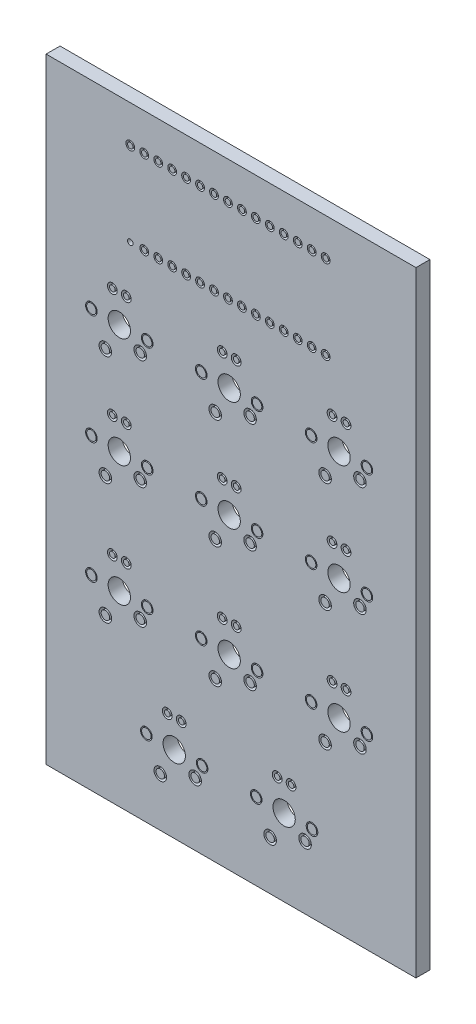
from build123d import *

# Parameters (mm, degrees)
SKETCH2_R           = 0.7999984
SKETCH2_R_2         = 1.143
SKETCH2_R_3         = 1.057148
SKETCH2_R_4         = 0.889
SKETCH2_R_5         = 0.499999
SKETCH2_R_6         = 2.032
BOSS_EXTRUDE2_DEPTH = 2.54


with BuildPart() as part:
    # Sketch2 → Boss-Extrude2 (new body)
    # profile 1 of 96: a face of its own
    with BuildSketch(Plane.XY):
        Polygon((0.6731, 111.99876), (68.00088, 111.99876), (68.00088, 0), (0.6731, 0), (0.6731, 40.5511), align=None)
        with Locations((18.5399934, 89.9999978)):
            Circle(SKETCH2_R, mode=Mode.SUBTRACT)
        with Locations((21.0799934, 89.9999978)):
            Circle(SKETCH2_R, mode=Mode.SUBTRACT)
        with Locations((23.6199934, 89.9999978)):
            Circle(SKETCH2_R, mode=Mode.SUBTRACT)
        with Locations((26.1599934, 89.9999978)):
            Circle(SKETCH2_R, mode=Mode.SUBTRACT)
        with Locations((28.6999934, 89.9999978)):
            Circle(SKETCH2_R, mode=Mode.SUBTRACT)
        with Locations((31.2399934, 89.9999978)):
            Circle(SKETCH2_R, mode=Mode.SUBTRACT)
        with Locations((33.7799934, 89.9999978)):
            Circle(SKETCH2_R, mode=Mode.SUBTRACT)
        with Locations((36.3199934, 89.9999978)):
            Circle(SKETCH2_R, mode=Mode.SUBTRACT)
        with Locations((38.8599934, 89.9999978)):
            Circle(SKETCH2_R, mode=Mode.SUBTRACT)
        with Locations((41.3999934, 89.9999978)):
            Circle(SKETCH2_R, mode=Mode.SUBTRACT)
        with Locations((43.9399934, 89.9999978)):
            Circle(SKETCH2_R, mode=Mode.SUBTRACT)
        with Locations((46.4799934, 89.9999978)):
            Circle(SKETCH2_R, mode=Mode.SUBTRACT)
        with Locations((49.0199934, 89.9999978)):
            Circle(SKETCH2_R, mode=Mode.SUBTRACT)
        with Locations((51.5599934, 89.9999978)):
            Circle(SKETCH2_R, mode=Mode.SUBTRACT)
        with Locations((51.5599934, 105.2399978)):
            Circle(SKETCH2_R, mode=Mode.SUBTRACT)
        with Locations((49.0199934, 105.2399978)):
            Circle(SKETCH2_R, mode=Mode.SUBTRACT)
        with Locations((46.4799934, 105.2399978)):
            Circle(SKETCH2_R, mode=Mode.SUBTRACT)
        with Locations((43.9399934, 105.2399978)):
            Circle(SKETCH2_R, mode=Mode.SUBTRACT)
        with Locations((41.3999934, 105.2399978)):
            Circle(SKETCH2_R, mode=Mode.SUBTRACT)
        with Locations((38.8599934, 105.2399978)):
            Circle(SKETCH2_R, mode=Mode.SUBTRACT)
        with Locations((36.3199934, 105.2399978)):
            Circle(SKETCH2_R, mode=Mode.SUBTRACT)
        with Locations((33.7799934, 105.2399978)):
            Circle(SKETCH2_R, mode=Mode.SUBTRACT)
        with Locations((31.2399934, 105.2399978)):
            Circle(SKETCH2_R, mode=Mode.SUBTRACT)
        with Locations((28.6999934, 105.2399978)):
            Circle(SKETCH2_R, mode=Mode.SUBTRACT)
        with Locations((26.1599934, 105.2399978)):
            Circle(SKETCH2_R, mode=Mode.SUBTRACT)
        with Locations((23.6199934, 105.2399978)):
            Circle(SKETCH2_R, mode=Mode.SUBTRACT)
        with Locations((21.0799934, 105.2399978)):
            Circle(SKETCH2_R, mode=Mode.SUBTRACT)
        with Locations((18.5399934, 105.2399978)):
            Circle(SKETCH2_R, mode=Mode.SUBTRACT)
        with Locations((15.9999934, 105.2399978)):
            Circle(SKETCH2_R, mode=Mode.SUBTRACT)
        with Locations((17.8099974, 53.4599896)):
            Circle(SKETCH2_R_2, mode=Mode.SUBTRACT)
        with Locations((11.4599974, 50.9199896)):
            Circle(SKETCH2_R_2, mode=Mode.SUBTRACT)
        with Locations((19.0799974, 55.9999896)):
            Circle(SKETCH2_R_3, mode=Mode.SUBTRACT)
        with Locations((8.9199974, 55.9999896)):
            Circle(SKETCH2_R_3, mode=Mode.SUBTRACT)
        with Locations((15.2699974, 61.0799896)):
            Circle(SKETCH2_R_4, mode=Mode.SUBTRACT)
        with Locations((12.7299974, 61.0799896)):
            Circle(SKETCH2_R_4, mode=Mode.SUBTRACT)
        with Locations((37.8099828, 53.4599896)):
            Circle(SKETCH2_R_2, mode=Mode.SUBTRACT)
        with Locations((31.4599828, 50.9199896)):
            Circle(SKETCH2_R_2, mode=Mode.SUBTRACT)
        with Locations((39.0799828, 55.9999896)):
            Circle(SKETCH2_R_3, mode=Mode.SUBTRACT)
        with Locations((28.9199828, 55.9999896)):
            Circle(SKETCH2_R_3, mode=Mode.SUBTRACT)
        with Locations((35.2699828, 61.0799896)):
            Circle(SKETCH2_R_4, mode=Mode.SUBTRACT)
        with Locations((32.7299828, 61.0799896)):
            Circle(SKETCH2_R_4, mode=Mode.SUBTRACT)
        with Locations((17.8099974, 31.4599828)):
            Circle(SKETCH2_R_2, mode=Mode.SUBTRACT)
        with Locations((11.4599974, 28.9199828)):
            Circle(SKETCH2_R_2, mode=Mode.SUBTRACT)
        with Locations((19.0799974, 33.9999828)):
            Circle(SKETCH2_R_3, mode=Mode.SUBTRACT)
        with Locations((8.9199974, 33.9999828)):
            Circle(SKETCH2_R_3, mode=Mode.SUBTRACT)
        with Locations((15.2699974, 39.0799828)):
            Circle(SKETCH2_R_4, mode=Mode.SUBTRACT)
        with Locations((12.7299974, 39.0799828)):
            Circle(SKETCH2_R_4, mode=Mode.SUBTRACT)
        with Locations((37.8099828, 31.4599828)):
            Circle(SKETCH2_R_2, mode=Mode.SUBTRACT)
        with Locations((31.4599828, 28.9199828)):
            Circle(SKETCH2_R_2, mode=Mode.SUBTRACT)
        with Locations((39.0799828, 33.9999828)):
            Circle(SKETCH2_R_3, mode=Mode.SUBTRACT)
        with Locations((28.9199828, 33.9999828)):
            Circle(SKETCH2_R_3, mode=Mode.SUBTRACT)
        with Locations((35.2699828, 39.0799828)):
            Circle(SKETCH2_R_4, mode=Mode.SUBTRACT)
        with Locations((32.7299828, 39.0799828)):
            Circle(SKETCH2_R_4, mode=Mode.SUBTRACT)
        with Locations((57.8099936, 53.4599896)):
            Circle(SKETCH2_R_2, mode=Mode.SUBTRACT)
        with Locations((51.4599936, 50.9199896)):
            Circle(SKETCH2_R_2, mode=Mode.SUBTRACT)
        with Locations((59.0799936, 55.9999896)):
            Circle(SKETCH2_R_3, mode=Mode.SUBTRACT)
        with Locations((48.9199936, 55.9999896)):
            Circle(SKETCH2_R_3, mode=Mode.SUBTRACT)
        with Locations((55.2699936, 61.0799896)):
            Circle(SKETCH2_R_4, mode=Mode.SUBTRACT)
        with Locations((52.7299936, 61.0799896)):
            Circle(SKETCH2_R_4, mode=Mode.SUBTRACT)
        with Locations((57.8099936, 31.4599828)):
            Circle(SKETCH2_R_2, mode=Mode.SUBTRACT)
        with Locations((51.4599936, 28.9199828)):
            Circle(SKETCH2_R_2, mode=Mode.SUBTRACT)
        with Locations((59.0799936, 33.9999828)):
            Circle(SKETCH2_R_3, mode=Mode.SUBTRACT)
        with Locations((48.9199936, 33.9999828)):
            Circle(SKETCH2_R_3, mode=Mode.SUBTRACT)
        with Locations((55.2699936, 39.0799828)):
            Circle(SKETCH2_R_4, mode=Mode.SUBTRACT)
        with Locations((52.7299936, 39.0799828)):
            Circle(SKETCH2_R_4, mode=Mode.SUBTRACT)
        with Locations((27.809952, 11.4599974)):
            Circle(SKETCH2_R_2, mode=Mode.SUBTRACT)
        with Locations((21.459952, 8.9199974)):
            Circle(SKETCH2_R_2, mode=Mode.SUBTRACT)
        with Locations((29.079952, 13.9999974)):
            Circle(SKETCH2_R_3, mode=Mode.SUBTRACT)
        with Locations((18.919952, 13.9999974)):
            Circle(SKETCH2_R_3, mode=Mode.SUBTRACT)
        with Locations((25.269952, 19.0799974)):
            Circle(SKETCH2_R_4, mode=Mode.SUBTRACT)
        with Locations((22.729952, 19.0799974)):
            Circle(SKETCH2_R_4, mode=Mode.SUBTRACT)
        with Locations((47.8099882, 11.4599974)):
            Circle(SKETCH2_R_2, mode=Mode.SUBTRACT)
        with Locations((41.4599882, 8.9199974)):
            Circle(SKETCH2_R_2, mode=Mode.SUBTRACT)
        with Locations((49.0799882, 13.9999974)):
            Circle(SKETCH2_R_3, mode=Mode.SUBTRACT)
        with Locations((38.9199882, 13.9999974)):
            Circle(SKETCH2_R_3, mode=Mode.SUBTRACT)
        with Locations((45.2699882, 19.0799974)):
            Circle(SKETCH2_R_4, mode=Mode.SUBTRACT)
        with Locations((42.7299882, 19.0799974)):
            Circle(SKETCH2_R_4, mode=Mode.SUBTRACT)
        with Locations((17.8099974, 73.4600004)):
            Circle(SKETCH2_R_2, mode=Mode.SUBTRACT)
        with Locations((11.4599974, 70.9200004)):
            Circle(SKETCH2_R_2, mode=Mode.SUBTRACT)
        with Locations((19.0799974, 76.0000004)):
            Circle(SKETCH2_R_3, mode=Mode.SUBTRACT)
        with Locations((8.9199974, 76.0000004)):
            Circle(SKETCH2_R_3, mode=Mode.SUBTRACT)
        with Locations((15.2699974, 81.0800004)):
            Circle(SKETCH2_R_4, mode=Mode.SUBTRACT)
        with Locations((12.7299974, 81.0800004)):
            Circle(SKETCH2_R_4, mode=Mode.SUBTRACT)
        with Locations((37.8099828, 73.4600004)):
            Circle(SKETCH2_R_2, mode=Mode.SUBTRACT)
        with Locations((31.4599828, 70.9200004)):
            Circle(SKETCH2_R_2, mode=Mode.SUBTRACT)
        with Locations((39.0799828, 76.0000004)):
            Circle(SKETCH2_R_3, mode=Mode.SUBTRACT)
        with Locations((28.9199828, 76.0000004)):
            Circle(SKETCH2_R_3, mode=Mode.SUBTRACT)
        with Locations((35.2699828, 81.0800004)):
            Circle(SKETCH2_R_4, mode=Mode.SUBTRACT)
        with Locations((32.7299828, 81.0800004)):
            Circle(SKETCH2_R_4, mode=Mode.SUBTRACT)
        with Locations((57.8099936, 73.4600004)):
            Circle(SKETCH2_R_2, mode=Mode.SUBTRACT)
        with Locations((51.4599936, 70.9200004)):
            Circle(SKETCH2_R_2, mode=Mode.SUBTRACT)
        with Locations((59.0799936, 76.0000004)):
            Circle(SKETCH2_R_3, mode=Mode.SUBTRACT)
        with Locations((48.9199936, 76.0000004)):
            Circle(SKETCH2_R_3, mode=Mode.SUBTRACT)
        with Locations((55.2699936, 81.0800004)):
            Circle(SKETCH2_R_4, mode=Mode.SUBTRACT)
        with Locations((52.7299936, 81.0800004)):
            Circle(SKETCH2_R_4, mode=Mode.SUBTRACT)
        with Locations((15.9999934, 89.9999978)):
            Circle(SKETCH2_R_5, mode=Mode.SUBTRACT)
        with Locations((13.9999974, 55.9999896)):
            Circle(SKETCH2_R_6, mode=Mode.SUBTRACT)
        with Locations((33.9999828, 55.9999896)):
            Circle(SKETCH2_R_6, mode=Mode.SUBTRACT)
        with Locations((13.9999974, 33.9999828)):
            Circle(SKETCH2_R_6, mode=Mode.SUBTRACT)
        with Locations((33.9999828, 33.9999828)):
            Circle(SKETCH2_R_6, mode=Mode.SUBTRACT)
        with Locations((53.9999936, 55.9999896)):
            Circle(SKETCH2_R_6, mode=Mode.SUBTRACT)
        with Locations((53.9999936, 33.9999828)):
            Circle(SKETCH2_R_6, mode=Mode.SUBTRACT)
        with Locations((23.9999774, 13.9999974)):
            Circle(SKETCH2_R_6, mode=Mode.SUBTRACT)
        with Locations((43.9999882, 13.9999974)):
            Circle(SKETCH2_R_6, mode=Mode.SUBTRACT)
        with Locations((13.9999974, 76.0000004)):
            Circle(SKETCH2_R_6, mode=Mode.SUBTRACT)
        with Locations((33.9999828, 76.0000004)):
            Circle(SKETCH2_R_6, mode=Mode.SUBTRACT)
        with Locations((53.9999936, 76.0000004)):
            Circle(SKETCH2_R_6, mode=Mode.SUBTRACT)
    # profile 2 of 96: a face of its own
    with BuildSketch(Plane.XY):
        with Locations((15.9999934, 105.2399978)):
            Circle(SKETCH2_R_5)
    # profile 3 of 96: a face of its own
    with BuildSketch(Plane.XY):
        with Locations((18.5399934, 105.2399978)):
            Circle(SKETCH2_R_5)
    # profile 4 of 96: a face of its own
    with BuildSketch(Plane.XY):
        with Locations((21.0799934, 105.2399978)):
            Circle(SKETCH2_R_5)
    # profile 5 of 96: a face of its own
    with BuildSketch(Plane.XY):
        with Locations((23.6199934, 105.2399978)):
            Circle(SKETCH2_R_5)
    # profile 6 of 96: a face of its own
    with BuildSketch(Plane.XY):
        with Locations((26.1599934, 105.2399978)):
            Circle(SKETCH2_R_5)
    # profile 7 of 96: a face of its own
    with BuildSketch(Plane.XY):
        with Locations((28.6999934, 105.2399978)):
            Circle(SKETCH2_R_5)
    # profile 8 of 96: a face of its own
    with BuildSketch(Plane.XY):
        with Locations((31.2399934, 105.2399978)):
            Circle(SKETCH2_R_5)
    # profile 9 of 96: a face of its own
    with BuildSketch(Plane.XY):
        with Locations((33.7799934, 105.2399978)):
            Circle(SKETCH2_R_5)
    # profile 10 of 96: a face of its own
    with BuildSketch(Plane.XY):
        with Locations((36.3199934, 105.2399978)):
            Circle(SKETCH2_R_5)
    # profile 11 of 96: a face of its own
    with BuildSketch(Plane.XY):
        with Locations((38.8599934, 105.2399978)):
            Circle(SKETCH2_R_5)
    # profile 12 of 96: a face of its own
    with BuildSketch(Plane.XY):
        with Locations((41.3999934, 105.2399978)):
            Circle(SKETCH2_R_5)
    # profile 13 of 96: a face of its own
    with BuildSketch(Plane.XY):
        with Locations((43.9399934, 105.2399978)):
            Circle(SKETCH2_R_5)
    # profile 14 of 96: a face of its own
    with BuildSketch(Plane.XY):
        with Locations((46.4799934, 105.2399978)):
            Circle(SKETCH2_R_5)
    # profile 15 of 96: a face of its own
    with BuildSketch(Plane.XY):
        with Locations((49.0199934, 105.2399978)):
            Circle(SKETCH2_R_5)
    # profile 16 of 96: a face of its own
    with BuildSketch(Plane.XY):
        with Locations((51.5599934, 105.2399978)):
            Circle(SKETCH2_R_5)
    # profile 17 of 96: a face of its own
    with BuildSketch(Plane.XY):
        with Locations((51.5599934, 89.9999978)):
            Circle(SKETCH2_R_5)
    # profile 18 of 96: a face of its own
    with BuildSketch(Plane.XY):
        with Locations((49.0199934, 89.9999978)):
            Circle(SKETCH2_R_5)
    # profile 19 of 96: a face of its own
    with BuildSketch(Plane.XY):
        with Locations((46.4799934, 89.9999978)):
            Circle(SKETCH2_R_5)
    # profile 20 of 96: a face of its own
    with BuildSketch(Plane.XY):
        with Locations((43.9399934, 89.9999978)):
            Circle(SKETCH2_R_5)
    # profile 21 of 96: a face of its own
    with BuildSketch(Plane.XY):
        with Locations((41.3999934, 89.9999978)):
            Circle(SKETCH2_R_5)
    # profile 22 of 96: a face of its own
    with BuildSketch(Plane.XY):
        with Locations((38.8599934, 89.9999978)):
            Circle(SKETCH2_R_5)
    # profile 23 of 96: a face of its own
    with BuildSketch(Plane.XY):
        with Locations((36.3199934, 89.9999978)):
            Circle(SKETCH2_R_5)
    # profile 24 of 96: a face of its own
    with BuildSketch(Plane.XY):
        with Locations((33.7799934, 89.9999978)):
            Circle(SKETCH2_R_5)
    # profile 25 of 96: a face of its own
    with BuildSketch(Plane.XY):
        with Locations((31.2399934, 89.9999978)):
            Circle(SKETCH2_R_5)
    # profile 26 of 96: a face of its own
    with BuildSketch(Plane.XY):
        with Locations((28.6999934, 89.9999978)):
            Circle(SKETCH2_R_5)
    # profile 27 of 96: a face of its own
    with BuildSketch(Plane.XY):
        with Locations((26.1599934, 89.9999978)):
            Circle(SKETCH2_R_5)
    # profile 28 of 96: a face of its own
    with BuildSketch(Plane.XY):
        with Locations((23.6199934, 89.9999978)):
            Circle(SKETCH2_R_5)
    # profile 29 of 96: a face of its own
    with BuildSketch(Plane.XY):
        with Locations((21.0799934, 89.9999978)):
            Circle(SKETCH2_R_5)
    # profile 30 of 96: a face of its own
    with BuildSketch(Plane.XY):
        with Locations((18.5399934, 89.9999978)):
            Circle(SKETCH2_R_5)
    # profile 31 of 96: a face of its own
    with BuildSketch(Plane.XY):
        with BuildLine():
            Line((17.8074574, 52.6979896), (17.8125374, 52.6979896))
            ThreePointArc((17.8125374, 52.6979896), (18.5745374, 53.4599896), (17.8125374, 54.2219896))
            Line((17.8125374, 54.2219896), (17.8074574, 54.2219896))
            ThreePointArc((17.8074574, 54.2219896), (17.0454574, 53.4599896), (17.8074574, 52.6979896))
        make_face()
    # profile 32 of 96: a face of its own
    with BuildSketch(Plane.XY):
        with BuildLine():
            Line((11.4574574, 50.1579896), (11.4625374, 50.1579896))
            ThreePointArc((11.4625374, 50.1579896), (12.2245374, 50.9199896), (11.4625374, 51.6819896))
            Line((11.4625374, 51.6819896), (11.4574574, 51.6819896))
            ThreePointArc((11.4574574, 51.6819896), (10.6954574, 50.9199896), (11.4574574, 50.1579896))
        make_face()
    # profile 33 of 96: a face of its own
    with BuildSketch(Plane.XY):
        with BuildLine():
            Line((19.0774574, 55.1427396), (19.0825374, 55.1427396))
            ThreePointArc((19.0825374, 55.1427396), (19.9397874, 55.9999896), (19.0825374, 56.8572396))
            Line((19.0825374, 56.8572396), (19.0774574, 56.8572396))
            ThreePointArc((19.0774574, 56.8572396), (18.2202074, 55.9999896), (19.0774574, 55.1427396))
        make_face()
    # profile 34 of 96: a face of its own
    with BuildSketch(Plane.XY):
        with BuildLine():
            Line((8.9174574, 55.1427396), (8.9225374, 55.1427396))
            ThreePointArc((8.9225374, 55.1427396), (9.7797874, 55.9999896), (8.9225374, 56.8572396))
            Line((8.9225374, 56.8572396), (8.9174574, 56.8572396))
            ThreePointArc((8.9174574, 56.8572396), (8.0602074, 55.9999896), (8.9174574, 55.1427396))
        make_face()
    # profile 35 of 96: a face of its own
    with BuildSketch(Plane.XY):
        with BuildLine():
            Line((15.2674574, 60.5719896), (15.2725374, 60.5719896))
            ThreePointArc((15.2725374, 60.5719896), (15.7805374, 61.0799896), (15.2725374, 61.5879896))
            Line((15.2725374, 61.5879896), (15.2674574, 61.5879896))
            ThreePointArc((15.2674574, 61.5879896), (14.7594574, 61.0799896), (15.2674574, 60.5719896))
        make_face()
    # profile 36 of 96: a face of its own
    with BuildSketch(Plane.XY):
        with BuildLine():
            Line((12.7274574, 60.5719896), (12.7325374, 60.5719896))
            ThreePointArc((12.7325374, 60.5719896), (13.2405374, 61.0799896), (12.7325374, 61.5879896))
            Line((12.7325374, 61.5879896), (12.7274574, 61.5879896))
            ThreePointArc((12.7274574, 61.5879896), (12.2194574, 61.0799896), (12.7274574, 60.5719896))
        make_face()
    # profile 37 of 96: a face of its own
    with BuildSketch(Plane.XY):
        with BuildLine():
            Line((37.8074428, 52.6979896), (37.8125228, 52.6979896))
            ThreePointArc((37.8125228, 52.6979896), (38.5745228, 53.4599896), (37.8125228, 54.2219896))
            Line((37.8125228, 54.2219896), (37.8074428, 54.2219896))
            ThreePointArc((37.8074428, 54.2219896), (37.0454428, 53.4599896), (37.8074428, 52.6979896))
        make_face()
    # profile 38 of 96: a face of its own
    with BuildSketch(Plane.XY):
        with BuildLine():
            Line((31.4574428, 50.1579896), (31.4625228, 50.1579896))
            ThreePointArc((31.4625228, 50.1579896), (32.2245228, 50.9199896), (31.4625228, 51.6819896))
            Line((31.4625228, 51.6819896), (31.4574428, 51.6819896))
            ThreePointArc((31.4574428, 51.6819896), (30.6954428, 50.9199896), (31.4574428, 50.1579896))
        make_face()
    # profile 39 of 96: a face of its own
    with BuildSketch(Plane.XY):
        with BuildLine():
            Line((39.0774428, 55.1427396), (39.0825228, 55.1427396))
            ThreePointArc((39.0825228, 55.1427396), (39.9397728, 55.9999896), (39.0825228, 56.8572396))
            Line((39.0825228, 56.8572396), (39.0774428, 56.8572396))
            ThreePointArc((39.0774428, 56.8572396), (38.2201928, 55.9999896), (39.0774428, 55.1427396))
        make_face()
    # profile 40 of 96: a face of its own
    with BuildSketch(Plane.XY):
        with BuildLine():
            Line((28.9174428, 55.1427396), (28.9225228, 55.1427396))
            ThreePointArc((28.9225228, 55.1427396), (29.7797728, 55.9999896), (28.9225228, 56.8572396))
            Line((28.9225228, 56.8572396), (28.9174428, 56.8572396))
            ThreePointArc((28.9174428, 56.8572396), (28.0601928, 55.9999896), (28.9174428, 55.1427396))
        make_face()
    # profile 41 of 96: a face of its own
    with BuildSketch(Plane.XY):
        with BuildLine():
            Line((35.2674428, 60.5719896), (35.2725228, 60.5719896))
            ThreePointArc((35.2725228, 60.5719896), (35.7805228, 61.0799896), (35.2725228, 61.5879896))
            Line((35.2725228, 61.5879896), (35.2674428, 61.5879896))
            ThreePointArc((35.2674428, 61.5879896), (34.7594428, 61.0799896), (35.2674428, 60.5719896))
        make_face()
    # profile 42 of 96: a face of its own
    with BuildSketch(Plane.XY):
        with BuildLine():
            Line((32.7274428, 60.5719896), (32.7325228, 60.5719896))
            ThreePointArc((32.7325228, 60.5719896), (33.2405228, 61.0799896), (32.7325228, 61.5879896))
            Line((32.7325228, 61.5879896), (32.7274428, 61.5879896))
            ThreePointArc((32.7274428, 61.5879896), (32.2194428, 61.0799896), (32.7274428, 60.5719896))
        make_face()
    # profile 43 of 96: a face of its own
    with BuildSketch(Plane.XY):
        with BuildLine():
            Line((17.8074574, 30.6979828), (17.8125374, 30.6979828))
            ThreePointArc((17.8125374, 30.6979828), (18.5745374, 31.4599828), (17.8125374, 32.2219828))
            Line((17.8125374, 32.2219828), (17.8074574, 32.2219828))
            ThreePointArc((17.8074574, 32.2219828), (17.0454574, 31.4599828), (17.8074574, 30.6979828))
        make_face()
    # profile 44 of 96: a face of its own
    with BuildSketch(Plane.XY):
        with BuildLine():
            Line((11.4574574, 28.1579828), (11.4625374, 28.1579828))
            ThreePointArc((11.4625374, 28.1579828), (12.2245374, 28.9199828), (11.4625374, 29.6819828))
            Line((11.4625374, 29.6819828), (11.4574574, 29.6819828))
            ThreePointArc((11.4574574, 29.6819828), (10.6954574, 28.9199828), (11.4574574, 28.1579828))
        make_face()
    # profile 45 of 96: a face of its own
    with BuildSketch(Plane.XY):
        with BuildLine():
            Line((19.0774574, 33.1427328), (19.0825374, 33.1427328))
            ThreePointArc((19.0825374, 33.1427328), (19.9397874, 33.9999828), (19.0825374, 34.8572328))
            Line((19.0825374, 34.8572328), (19.0774574, 34.8572328))
            ThreePointArc((19.0774574, 34.8572328), (18.2202074, 33.9999828), (19.0774574, 33.1427328))
        make_face()
    # profile 46 of 96: a face of its own
    with BuildSketch(Plane.XY):
        with BuildLine():
            Line((8.9174574, 33.1427328), (8.9225374, 33.1427328))
            ThreePointArc((8.9225374, 33.1427328), (9.7797874, 33.9999828), (8.9225374, 34.8572328))
            Line((8.9225374, 34.8572328), (8.9174574, 34.8572328))
            ThreePointArc((8.9174574, 34.8572328), (8.0602074, 33.9999828), (8.9174574, 33.1427328))
        make_face()
    # profile 47 of 96: a face of its own
    with BuildSketch(Plane.XY):
        with BuildLine():
            Line((15.2674574, 38.5719828), (15.2725374, 38.5719828))
            ThreePointArc((15.2725374, 38.5719828), (15.7805374, 39.0799828), (15.2725374, 39.5879828))
            Line((15.2725374, 39.5879828), (15.2674574, 39.5879828))
            ThreePointArc((15.2674574, 39.5879828), (14.7594574, 39.0799828), (15.2674574, 38.5719828))
        make_face()
    # profile 48 of 96: a face of its own
    with BuildSketch(Plane.XY):
        with BuildLine():
            Line((12.7274574, 38.5719828), (12.7325374, 38.5719828))
            ThreePointArc((12.7325374, 38.5719828), (13.2405374, 39.0799828), (12.7325374, 39.5879828))
            Line((12.7325374, 39.5879828), (12.7274574, 39.5879828))
            ThreePointArc((12.7274574, 39.5879828), (12.2194574, 39.0799828), (12.7274574, 38.5719828))
        make_face()
    # profile 49 of 96: a face of its own
    with BuildSketch(Plane.XY):
        with BuildLine():
            Line((37.8074428, 30.6979828), (37.8125228, 30.6979828))
            ThreePointArc((37.8125228, 30.6979828), (38.5745228, 31.4599828), (37.8125228, 32.2219828))
            Line((37.8125228, 32.2219828), (37.8074428, 32.2219828))
            ThreePointArc((37.8074428, 32.2219828), (37.0454428, 31.4599828), (37.8074428, 30.6979828))
        make_face()
    # profile 50 of 96: a face of its own
    with BuildSketch(Plane.XY):
        with BuildLine():
            Line((31.4574428, 28.1579828), (31.4625228, 28.1579828))
            ThreePointArc((31.4625228, 28.1579828), (32.2245228, 28.9199828), (31.4625228, 29.6819828))
            Line((31.4625228, 29.6819828), (31.4574428, 29.6819828))
            ThreePointArc((31.4574428, 29.6819828), (30.6954428, 28.9199828), (31.4574428, 28.1579828))
        make_face()
    # profile 51 of 96: a face of its own
    with BuildSketch(Plane.XY):
        with BuildLine():
            Line((39.0774428, 33.1427328), (39.0825228, 33.1427328))
            ThreePointArc((39.0825228, 33.1427328), (39.9397728, 33.9999828), (39.0825228, 34.8572328))
            Line((39.0825228, 34.8572328), (39.0774428, 34.8572328))
            ThreePointArc((39.0774428, 34.8572328), (38.2201928, 33.9999828), (39.0774428, 33.1427328))
        make_face()
    # profile 52 of 96: a face of its own
    with BuildSketch(Plane.XY):
        with BuildLine():
            Line((28.9174428, 33.1427328), (28.9225228, 33.1427328))
            ThreePointArc((28.9225228, 33.1427328), (29.7797728, 33.9999828), (28.9225228, 34.8572328))
            Line((28.9225228, 34.8572328), (28.9174428, 34.8572328))
            ThreePointArc((28.9174428, 34.8572328), (28.0601928, 33.9999828), (28.9174428, 33.1427328))
        make_face()
    # profile 53 of 96: a face of its own
    with BuildSketch(Plane.XY):
        with BuildLine():
            Line((35.2674428, 38.5719828), (35.2725228, 38.5719828))
            ThreePointArc((35.2725228, 38.5719828), (35.7805228, 39.0799828), (35.2725228, 39.5879828))
            Line((35.2725228, 39.5879828), (35.2674428, 39.5879828))
            ThreePointArc((35.2674428, 39.5879828), (34.7594428, 39.0799828), (35.2674428, 38.5719828))
        make_face()
    # profile 54 of 96: a face of its own
    with BuildSketch(Plane.XY):
        with BuildLine():
            Line((32.7274428, 38.5719828), (32.7325228, 38.5719828))
            ThreePointArc((32.7325228, 38.5719828), (33.2405228, 39.0799828), (32.7325228, 39.5879828))
            Line((32.7325228, 39.5879828), (32.7274428, 39.5879828))
            ThreePointArc((32.7274428, 39.5879828), (32.2194428, 39.0799828), (32.7274428, 38.5719828))
        make_face()
    # profile 55 of 96: a face of its own
    with BuildSketch(Plane.XY):
        with BuildLine():
            Line((57.8074536, 52.6979896), (57.8125336, 52.6979896))
            ThreePointArc((57.8125336, 52.6979896), (58.5745336, 53.4599896), (57.8125336, 54.2219896))
            Line((57.8125336, 54.2219896), (57.8074536, 54.2219896))
            ThreePointArc((57.8074536, 54.2219896), (57.0454536, 53.4599896), (57.8074536, 52.6979896))
        make_face()
    # profile 56 of 96: a face of its own
    with BuildSketch(Plane.XY):
        with BuildLine():
            Line((51.4574536, 50.1579896), (51.4625336, 50.1579896))
            ThreePointArc((51.4625336, 50.1579896), (52.2245336, 50.9199896), (51.4625336, 51.6819896))
            Line((51.4625336, 51.6819896), (51.4574536, 51.6819896))
            ThreePointArc((51.4574536, 51.6819896), (50.6954536, 50.9199896), (51.4574536, 50.1579896))
        make_face()
    # profile 57 of 96: a face of its own
    with BuildSketch(Plane.XY):
        with BuildLine():
            Line((59.0774536, 55.1427396), (59.0825336, 55.1427396))
            ThreePointArc((59.0825336, 55.1427396), (59.9397836, 55.9999896), (59.0825336, 56.8572396))
            Line((59.0825336, 56.8572396), (59.0774536, 56.8572396))
            ThreePointArc((59.0774536, 56.8572396), (58.2202036, 55.9999896), (59.0774536, 55.1427396))
        make_face()
    # profile 58 of 96: a face of its own
    with BuildSketch(Plane.XY):
        with BuildLine():
            Line((48.9174536, 55.1427396), (48.9225336, 55.1427396))
            ThreePointArc((48.9225336, 55.1427396), (49.7797836, 55.9999896), (48.9225336, 56.8572396))
            Line((48.9225336, 56.8572396), (48.9174536, 56.8572396))
            ThreePointArc((48.9174536, 56.8572396), (48.0602036, 55.9999896), (48.9174536, 55.1427396))
        make_face()
    # profile 59 of 96: a face of its own
    with BuildSketch(Plane.XY):
        with BuildLine():
            Line((55.2674536, 60.5719896), (55.2725336, 60.5719896))
            ThreePointArc((55.2725336, 60.5719896), (55.7805336, 61.0799896), (55.2725336, 61.5879896))
            Line((55.2725336, 61.5879896), (55.2674536, 61.5879896))
            ThreePointArc((55.2674536, 61.5879896), (54.7594536, 61.0799896), (55.2674536, 60.5719896))
        make_face()
    # profile 60 of 96: a face of its own
    with BuildSketch(Plane.XY):
        with BuildLine():
            Line((52.7274536, 60.5719896), (52.7325336, 60.5719896))
            ThreePointArc((52.7325336, 60.5719896), (53.2405336, 61.0799896), (52.7325336, 61.5879896))
            Line((52.7325336, 61.5879896), (52.7274536, 61.5879896))
            ThreePointArc((52.7274536, 61.5879896), (52.2194536, 61.0799896), (52.7274536, 60.5719896))
        make_face()
    # profile 61 of 96: a face of its own
    with BuildSketch(Plane.XY):
        with BuildLine():
            Line((57.8074536, 30.6979828), (57.8125336, 30.6979828))
            ThreePointArc((57.8125336, 30.6979828), (58.5745336, 31.4599828), (57.8125336, 32.2219828))
            Line((57.8125336, 32.2219828), (57.8074536, 32.2219828))
            ThreePointArc((57.8074536, 32.2219828), (57.0454536, 31.4599828), (57.8074536, 30.6979828))
        make_face()
    # profile 62 of 96: a face of its own
    with BuildSketch(Plane.XY):
        with BuildLine():
            Line((51.4574536, 28.1579828), (51.4625336, 28.1579828))
            ThreePointArc((51.4625336, 28.1579828), (52.2245336, 28.9199828), (51.4625336, 29.6819828))
            Line((51.4625336, 29.6819828), (51.4574536, 29.6819828))
            ThreePointArc((51.4574536, 29.6819828), (50.6954536, 28.9199828), (51.4574536, 28.1579828))
        make_face()
    # profile 63 of 96: a face of its own
    with BuildSketch(Plane.XY):
        with BuildLine():
            Line((59.0774536, 33.1427328), (59.0825336, 33.1427328))
            ThreePointArc((59.0825336, 33.1427328), (59.9397836, 33.9999828), (59.0825336, 34.8572328))
            Line((59.0825336, 34.8572328), (59.0774536, 34.8572328))
            ThreePointArc((59.0774536, 34.8572328), (58.2202036, 33.9999828), (59.0774536, 33.1427328))
        make_face()
    # profile 64 of 96: a face of its own
    with BuildSketch(Plane.XY):
        with BuildLine():
            Line((48.9174536, 33.1427328), (48.9225336, 33.1427328))
            ThreePointArc((48.9225336, 33.1427328), (49.7797836, 33.9999828), (48.9225336, 34.8572328))
            Line((48.9225336, 34.8572328), (48.9174536, 34.8572328))
            ThreePointArc((48.9174536, 34.8572328), (48.0602036, 33.9999828), (48.9174536, 33.1427328))
        make_face()
    # profile 65 of 96: a face of its own
    with BuildSketch(Plane.XY):
        with BuildLine():
            Line((55.2674536, 38.5719828), (55.2725336, 38.5719828))
            ThreePointArc((55.2725336, 38.5719828), (55.7805336, 39.0799828), (55.2725336, 39.5879828))
            Line((55.2725336, 39.5879828), (55.2674536, 39.5879828))
            ThreePointArc((55.2674536, 39.5879828), (54.7594536, 39.0799828), (55.2674536, 38.5719828))
        make_face()
    # profile 66 of 96: a face of its own
    with BuildSketch(Plane.XY):
        with BuildLine():
            Line((52.7274536, 38.5719828), (52.7325336, 38.5719828))
            ThreePointArc((52.7325336, 38.5719828), (53.2405336, 39.0799828), (52.7325336, 39.5879828))
            Line((52.7325336, 39.5879828), (52.7274536, 39.5879828))
            ThreePointArc((52.7274536, 39.5879828), (52.2194536, 39.0799828), (52.7274536, 38.5719828))
        make_face()
    # profile 67 of 96: a face of its own
    with BuildSketch(Plane.XY):
        with BuildLine():
            Line((27.807412, 10.6979974), (27.812492, 10.6979974))
            ThreePointArc((27.812492, 10.6979974), (28.574492, 11.4599974), (27.812492, 12.2219974))
            Line((27.812492, 12.2219974), (27.807412, 12.2219974))
            ThreePointArc((27.807412, 12.2219974), (27.045412, 11.4599974), (27.807412, 10.6979974))
        make_face()
    # profile 68 of 96: a face of its own
    with BuildSketch(Plane.XY):
        with BuildLine():
            Line((21.457412, 8.1579974), (21.462492, 8.1579974))
            ThreePointArc((21.462492, 8.1579974), (22.224492, 8.9199974), (21.462492, 9.6819974))
            Line((21.462492, 9.6819974), (21.457412, 9.6819974))
            ThreePointArc((21.457412, 9.6819974), (20.695412, 8.9199974), (21.457412, 8.1579974))
        make_face()
    # profile 69 of 96: a face of its own
    with BuildSketch(Plane.XY):
        with BuildLine():
            Line((29.077412, 13.1427474), (29.082492, 13.1427474))
            ThreePointArc((29.082492, 13.1427474), (29.939742, 13.9999974), (29.082492, 14.8572474))
            Line((29.082492, 14.8572474), (29.077412, 14.8572474))
            ThreePointArc((29.077412, 14.8572474), (28.220162, 13.9999974), (29.077412, 13.1427474))
        make_face()
    # profile 70 of 96: a face of its own
    with BuildSketch(Plane.XY):
        with BuildLine():
            Line((18.917412, 13.1427474), (18.922492, 13.1427474))
            ThreePointArc((18.922492, 13.1427474), (19.779742, 13.9999974), (18.922492, 14.8572474))
            Line((18.922492, 14.8572474), (18.917412, 14.8572474))
            ThreePointArc((18.917412, 14.8572474), (18.060162, 13.9999974), (18.917412, 13.1427474))
        make_face()
    # profile 71 of 96: a face of its own
    with BuildSketch(Plane.XY):
        with BuildLine():
            Line((25.267412, 18.5719974), (25.272492, 18.5719974))
            ThreePointArc((25.272492, 18.5719974), (25.780492, 19.0799974), (25.272492, 19.5879974))
            Line((25.272492, 19.5879974), (25.267412, 19.5879974))
            ThreePointArc((25.267412, 19.5879974), (24.759412, 19.0799974), (25.267412, 18.5719974))
        make_face()
    # profile 72 of 96: a face of its own
    with BuildSketch(Plane.XY):
        with BuildLine():
            Line((22.727412, 18.5719974), (22.732492, 18.5719974))
            ThreePointArc((22.732492, 18.5719974), (23.240492, 19.0799974), (22.732492, 19.5879974))
            Line((22.732492, 19.5879974), (22.727412, 19.5879974))
            ThreePointArc((22.727412, 19.5879974), (22.219412, 19.0799974), (22.727412, 18.5719974))
        make_face()
    # profile 73 of 96: a face of its own
    with BuildSketch(Plane.XY):
        with BuildLine():
            Line((47.8074482, 10.6979974), (47.8125282, 10.6979974))
            ThreePointArc((47.8125282, 10.6979974), (48.5745282, 11.4599974), (47.8125282, 12.2219974))
            Line((47.8125282, 12.2219974), (47.8074482, 12.2219974))
            ThreePointArc((47.8074482, 12.2219974), (47.0454482, 11.4599974), (47.8074482, 10.6979974))
        make_face()
    # profile 74 of 96: a face of its own
    with BuildSketch(Plane.XY):
        with BuildLine():
            Line((41.4574482, 8.1579974), (41.4625282, 8.1579974))
            ThreePointArc((41.4625282, 8.1579974), (42.2245282, 8.9199974), (41.4625282, 9.6819974))
            Line((41.4625282, 9.6819974), (41.4574482, 9.6819974))
            ThreePointArc((41.4574482, 9.6819974), (40.6954482, 8.9199974), (41.4574482, 8.1579974))
        make_face()
    # profile 75 of 96: a face of its own
    with BuildSketch(Plane.XY):
        with BuildLine():
            Line((49.0774482, 13.1427474), (49.0825282, 13.1427474))
            ThreePointArc((49.0825282, 13.1427474), (49.9397782, 13.9999974), (49.0825282, 14.8572474))
            Line((49.0825282, 14.8572474), (49.0774482, 14.8572474))
            ThreePointArc((49.0774482, 14.8572474), (48.2201982, 13.9999974), (49.0774482, 13.1427474))
        make_face()
    # profile 76 of 96: a face of its own
    with BuildSketch(Plane.XY):
        with BuildLine():
            Line((38.9174482, 13.1427474), (38.9225282, 13.1427474))
            ThreePointArc((38.9225282, 13.1427474), (39.7797782, 13.9999974), (38.9225282, 14.8572474))
            Line((38.9225282, 14.8572474), (38.9174482, 14.8572474))
            ThreePointArc((38.9174482, 14.8572474), (38.0601982, 13.9999974), (38.9174482, 13.1427474))
        make_face()
    # profile 77 of 96: a face of its own
    with BuildSketch(Plane.XY):
        with BuildLine():
            Line((45.2674482, 18.5719974), (45.2725282, 18.5719974))
            ThreePointArc((45.2725282, 18.5719974), (45.7805282, 19.0799974), (45.2725282, 19.5879974))
            Line((45.2725282, 19.5879974), (45.2674482, 19.5879974))
            ThreePointArc((45.2674482, 19.5879974), (44.7594482, 19.0799974), (45.2674482, 18.5719974))
        make_face()
    # profile 78 of 96: a face of its own
    with BuildSketch(Plane.XY):
        with BuildLine():
            Line((42.7274482, 18.5719974), (42.7325282, 18.5719974))
            ThreePointArc((42.7325282, 18.5719974), (43.2405282, 19.0799974), (42.7325282, 19.5879974))
            Line((42.7325282, 19.5879974), (42.7274482, 19.5879974))
            ThreePointArc((42.7274482, 19.5879974), (42.2194482, 19.0799974), (42.7274482, 18.5719974))
        make_face()
    # profile 79 of 96: a face of its own
    with BuildSketch(Plane.XY):
        with BuildLine():
            Line((17.8074574, 72.6980004), (17.8125374, 72.6980004))
            ThreePointArc((17.8125374, 72.6980004), (18.5745374, 73.4600004), (17.8125374, 74.2220004))
            Line((17.8125374, 74.2220004), (17.8074574, 74.2220004))
            ThreePointArc((17.8074574, 74.2220004), (17.0454574, 73.4600004), (17.8074574, 72.6980004))
        make_face()
    # profile 80 of 96: a face of its own
    with BuildSketch(Plane.XY):
        with BuildLine():
            Line((11.4574574, 70.1580004), (11.4625374, 70.1580004))
            ThreePointArc((11.4625374, 70.1580004), (12.2245374, 70.9200004), (11.4625374, 71.6820004))
            Line((11.4625374, 71.6820004), (11.4574574, 71.6820004))
            ThreePointArc((11.4574574, 71.6820004), (10.6954574, 70.9200004), (11.4574574, 70.1580004))
        make_face()
    # profile 81 of 96: a face of its own
    with BuildSketch(Plane.XY):
        with BuildLine():
            Line((19.0774574, 75.1427504), (19.0825374, 75.1427504))
            ThreePointArc((19.0825374, 75.1427504), (19.9397874, 76.0000004), (19.0825374, 76.8572504))
            Line((19.0825374, 76.8572504), (19.0774574, 76.8572504))
            ThreePointArc((19.0774574, 76.8572504), (18.2202074, 76.0000004), (19.0774574, 75.1427504))
        make_face()
    # profile 82 of 96: a face of its own
    with BuildSketch(Plane.XY):
        with BuildLine():
            Line((8.9174574, 75.1427504), (8.9225374, 75.1427504))
            ThreePointArc((8.9225374, 75.1427504), (9.7797874, 76.0000004), (8.9225374, 76.8572504))
            Line((8.9225374, 76.8572504), (8.9174574, 76.8572504))
            ThreePointArc((8.9174574, 76.8572504), (8.0602074, 76.0000004), (8.9174574, 75.1427504))
        make_face()
    # profile 83 of 96: a face of its own
    with BuildSketch(Plane.XY):
        with BuildLine():
            Line((15.2674574, 80.5720004), (15.2725374, 80.5720004))
            ThreePointArc((15.2725374, 80.5720004), (15.7805374, 81.0800004), (15.2725374, 81.5880004))
            Line((15.2725374, 81.5880004), (15.2674574, 81.5880004))
            ThreePointArc((15.2674574, 81.5880004), (14.7594574, 81.0800004), (15.2674574, 80.5720004))
        make_face()
    # profile 84 of 96: a face of its own
    with BuildSketch(Plane.XY):
        with BuildLine():
            Line((12.7274574, 80.5720004), (12.7325374, 80.5720004))
            ThreePointArc((12.7325374, 80.5720004), (13.2405374, 81.0800004), (12.7325374, 81.5880004))
            Line((12.7325374, 81.5880004), (12.7274574, 81.5880004))
            ThreePointArc((12.7274574, 81.5880004), (12.2194574, 81.0800004), (12.7274574, 80.5720004))
        make_face()
    # profile 85 of 96: a face of its own
    with BuildSketch(Plane.XY):
        with BuildLine():
            Line((37.8074428, 72.6980004), (37.8125228, 72.6980004))
            ThreePointArc((37.8125228, 72.6980004), (38.5745228, 73.4600004), (37.8125228, 74.2220004))
            Line((37.8125228, 74.2220004), (37.8074428, 74.2220004))
            ThreePointArc((37.8074428, 74.2220004), (37.0454428, 73.4600004), (37.8074428, 72.6980004))
        make_face()
    # profile 86 of 96: a face of its own
    with BuildSketch(Plane.XY):
        with BuildLine():
            Line((31.4574428, 70.1580004), (31.4625228, 70.1580004))
            ThreePointArc((31.4625228, 70.1580004), (32.2245228, 70.9200004), (31.4625228, 71.6820004))
            Line((31.4625228, 71.6820004), (31.4574428, 71.6820004))
            ThreePointArc((31.4574428, 71.6820004), (30.6954428, 70.9200004), (31.4574428, 70.1580004))
        make_face()
    # profile 87 of 96: a face of its own
    with BuildSketch(Plane.XY):
        with BuildLine():
            Line((39.0774428, 75.1427504), (39.0825228, 75.1427504))
            ThreePointArc((39.0825228, 75.1427504), (39.9397728, 76.0000004), (39.0825228, 76.8572504))
            Line((39.0825228, 76.8572504), (39.0774428, 76.8572504))
            ThreePointArc((39.0774428, 76.8572504), (38.2201928, 76.0000004), (39.0774428, 75.1427504))
        make_face()
    # profile 88 of 96: a face of its own
    with BuildSketch(Plane.XY):
        with BuildLine():
            Line((28.9174428, 75.1427504), (28.9225228, 75.1427504))
            ThreePointArc((28.9225228, 75.1427504), (29.7797728, 76.0000004), (28.9225228, 76.8572504))
            Line((28.9225228, 76.8572504), (28.9174428, 76.8572504))
            ThreePointArc((28.9174428, 76.8572504), (28.0601928, 76.0000004), (28.9174428, 75.1427504))
        make_face()
    # profile 89 of 96: a face of its own
    with BuildSketch(Plane.XY):
        with BuildLine():
            Line((35.2674428, 80.5720004), (35.2725228, 80.5720004))
            ThreePointArc((35.2725228, 80.5720004), (35.7805228, 81.0800004), (35.2725228, 81.5880004))
            Line((35.2725228, 81.5880004), (35.2674428, 81.5880004))
            ThreePointArc((35.2674428, 81.5880004), (34.7594428, 81.0800004), (35.2674428, 80.5720004))
        make_face()
    # profile 90 of 96: a face of its own
    with BuildSketch(Plane.XY):
        with BuildLine():
            Line((32.7274428, 80.5720004), (32.7325228, 80.5720004))
            ThreePointArc((32.7325228, 80.5720004), (33.2405228, 81.0800004), (32.7325228, 81.5880004))
            Line((32.7325228, 81.5880004), (32.7274428, 81.5880004))
            ThreePointArc((32.7274428, 81.5880004), (32.2194428, 81.0800004), (32.7274428, 80.5720004))
        make_face()
    # profile 91 of 96: a face of its own
    with BuildSketch(Plane.XY):
        with BuildLine():
            Line((57.8074536, 72.6980004), (57.8125336, 72.6980004))
            ThreePointArc((57.8125336, 72.6980004), (58.5745336, 73.4600004), (57.8125336, 74.2220004))
            Line((57.8125336, 74.2220004), (57.8074536, 74.2220004))
            ThreePointArc((57.8074536, 74.2220004), (57.0454536, 73.4600004), (57.8074536, 72.6980004))
        make_face()
    # profile 92 of 96: a face of its own
    with BuildSketch(Plane.XY):
        with BuildLine():
            Line((51.4574536, 70.1580004), (51.4625336, 70.1580004))
            ThreePointArc((51.4625336, 70.1580004), (52.2245336, 70.9200004), (51.4625336, 71.6820004))
            Line((51.4625336, 71.6820004), (51.4574536, 71.6820004))
            ThreePointArc((51.4574536, 71.6820004), (50.6954536, 70.9200004), (51.4574536, 70.1580004))
        make_face()
    # profile 93 of 96: a face of its own
    with BuildSketch(Plane.XY):
        with BuildLine():
            Line((59.0774536, 75.1427504), (59.0825336, 75.1427504))
            ThreePointArc((59.0825336, 75.1427504), (59.9397836, 76.0000004), (59.0825336, 76.8572504))
            Line((59.0825336, 76.8572504), (59.0774536, 76.8572504))
            ThreePointArc((59.0774536, 76.8572504), (58.2202036, 76.0000004), (59.0774536, 75.1427504))
        make_face()
    # profile 94 of 96: a face of its own
    with BuildSketch(Plane.XY):
        with BuildLine():
            Line((48.9174536, 75.1427504), (48.9225336, 75.1427504))
            ThreePointArc((48.9225336, 75.1427504), (49.7797836, 76.0000004), (48.9225336, 76.8572504))
            Line((48.9225336, 76.8572504), (48.9174536, 76.8572504))
            ThreePointArc((48.9174536, 76.8572504), (48.0602036, 76.0000004), (48.9174536, 75.1427504))
        make_face()
    # profile 95 of 96: a face of its own
    with BuildSketch(Plane.XY):
        with BuildLine():
            Line((55.2674536, 80.5720004), (55.2725336, 80.5720004))
            ThreePointArc((55.2725336, 80.5720004), (55.7805336, 81.0800004), (55.2725336, 81.5880004))
            Line((55.2725336, 81.5880004), (55.2674536, 81.5880004))
            ThreePointArc((55.2674536, 81.5880004), (54.7594536, 81.0800004), (55.2674536, 80.5720004))
        make_face()
    # profile 96 of 96: a face of its own
    with BuildSketch(Plane.XY):
        with BuildLine():
            Line((52.7274536, 80.5720004), (52.7325336, 80.5720004))
            ThreePointArc((52.7325336, 80.5720004), (53.2405336, 81.0800004), (52.7325336, 81.5880004))
            Line((52.7325336, 81.5880004), (52.7274536, 81.5880004))
            ThreePointArc((52.7274536, 81.5880004), (52.2194536, 81.0800004), (52.7274536, 80.5720004))
        make_face()
    extrude(amount=BOSS_EXTRUDE2_DEPTH)


solid = part.part
